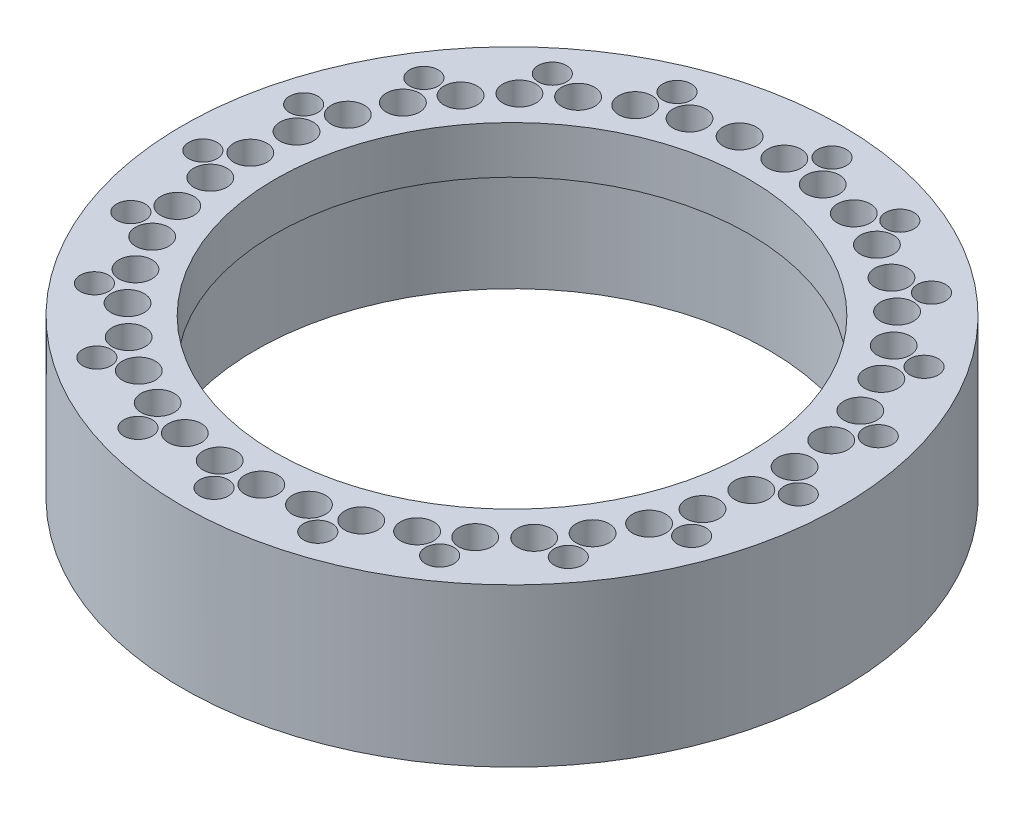
from build123d import *

# Parameters (mm, degrees)
BOSS_EXTRUDE1_OUTLINE_R                              = 37
BOSS_EXTRUDE1_OUTLINE_R_2                            = 2.1
BOSS_EXTRUDE1_OUTLINE_R_3                            = 32
BOSS_EXTRUDE1_DEPTH                                  = 4
BOSS_EXTRUDE2_START                                  = -2
SKETCH2_R                                            = 37
SKETCH2_R_2                                          = 32
BOSS_EXTRUDE2_DEPTH                                  = 2
BOSS_EXTRUDE3_OUTLINE_W                              = 2
BOSS_EXTRUDE3_OUTLINE_H                              = 4
BOSS_EXTRUDE4_START                                  = 4
SKETCH4_R                                            = 37
SKETCH4_R_2                                          = 32.5
BOSS_EXTRUDE4_DEPTH                                  = 4
BOSS_EXTRUDE5_START                                  = 10
SKETCH5_R                                            = 40
SKETCH5_R_2                                          = 32.5
BOSS_EXTRUDE5_DEPTH                                  = 10
SKETCH6_R                                            = 40
SKETCH6_R_2                                          = 37
BOSS_EXTRUDE6_DEPTH                                  = 10
M3_CLEARANCE_HOLE1_D                                 = 3.4
SKETCH9_R                                            = 41.75
SKETCH9_R_2                                          = 40
BOSS_EXTRUDE7_DEPTH                                  = 20
CSK_FOR_M3_SOCKET_COUNTERSUNK_HEAD_SCREW_D           = 3.6
CSK_FOR_M3_SOCKET_COUNTERSUNK_HEAD_SCREW_CSINK_D     = 6.94
CSK_FOR_M3_SOCKET_COUNTERSUNK_HEAD_SCREW_CSINK_ANGLE = 90
SKETCH13_R                                           = 32
SKETCH13_R_2                                         = 30
BOSS_EXTRUDE8_DEPTH                                  = 2


# Read off the part's stored shape, not the designer's step: Boss-Extrude1, Boss-Extrude3
with BuildPart() as part:
    # Boss-Extrude1 outline → Boss-Extrude1 (new body)
    with BuildSketch(Plane(origin=(0, 0, 0), x_dir=(1, 0, 0), z_dir=(0, 1, 0))):
        Circle(BOSS_EXTRUDE1_OUTLINE_R)
        with Locations((-28.958107202, -18.753080475)):
            Circle(BOSS_EXTRUDE1_OUTLINE_R_2, mode=Mode.SUBTRACT)
        with Locations((-21.95036426, -26.616376704)):
            Circle(BOSS_EXTRUDE1_OUTLINE_R_2, mode=Mode.SUBTRACT)
        with Locations((-25.756086146, -22.953736656)):
            Circle(BOSS_EXTRUDE1_OUTLINE_R_2, mode=Mode.SUBTRACT)
        with Locations((-17.630144441, -29.655151441)):
            Circle(BOSS_EXTRUDE1_OUTLINE_R_2, mode=Mode.SUBTRACT)
        with Locations((-12.896688979, -31.998834563)):
            Circle(BOSS_EXTRUDE1_OUTLINE_R_2, mode=Mode.SUBTRACT)
        with Locations((-7.860946057, -33.592492124)):
            Circle(BOSS_EXTRUDE1_OUTLINE_R_2, mode=Mode.SUBTRACT)
        with Locations((-2.640949223, -34.398770141)):
            Circle(BOSS_EXTRUDE1_OUTLINE_R_2, mode=Mode.SUBTRACT)
        with Locations((-31.481374768, -14.112867982)):
            Circle(BOSS_EXTRUDE1_OUTLINE_R_2, mode=Mode.SUBTRACT)
        with Locations((-33.266745593, -9.141861826)):
            Circle(BOSS_EXTRUDE1_OUTLINE_R_2, mode=Mode.SUBTRACT)
        with Locations((-34.272372097, -3.956578176)):
            Circle(BOSS_EXTRUDE1_OUTLINE_R_2, mode=Mode.SUBTRACT)
        with Locations((2.640949223, -34.398770141)):
            Circle(BOSS_EXTRUDE1_OUTLINE_R_2, mode=Mode.SUBTRACT)
        with Locations((7.860946057, -33.592492124)):
            Circle(BOSS_EXTRUDE1_OUTLINE_R_2, mode=Mode.SUBTRACT)
        with Locations((12.896688979, -31.998834563)):
            Circle(BOSS_EXTRUDE1_OUTLINE_R_2, mode=Mode.SUBTRACT)
        with Locations((17.630144441, -29.655151441)):
            Circle(BOSS_EXTRUDE1_OUTLINE_R_2, mode=Mode.SUBTRACT)
        with Locations((21.95036426, -26.616376704)):
            Circle(BOSS_EXTRUDE1_OUTLINE_R_2, mode=Mode.SUBTRACT)
        with Locations((25.756086146, -22.953736656)):
            Circle(BOSS_EXTRUDE1_OUTLINE_R_2, mode=Mode.SUBTRACT)
        with Locations((28.958107202, -18.753080475)):
            Circle(BOSS_EXTRUDE1_OUTLINE_R_2, mode=Mode.SUBTRACT)
        with Locations((31.481374768, -14.112867982)):
            Circle(BOSS_EXTRUDE1_OUTLINE_R_2, mode=Mode.SUBTRACT)
        with Locations((33.266745593, -9.141861826)):
            Circle(BOSS_EXTRUDE1_OUTLINE_R_2, mode=Mode.SUBTRACT)
        with Locations((34.272372097, -3.956578176)):
            Circle(BOSS_EXTRUDE1_OUTLINE_R_2, mode=Mode.SUBTRACT)
        with Locations((-34.474683246, 1.321444312)):
            Circle(BOSS_EXTRUDE1_OUTLINE_R_2, mode=Mode.SUBTRACT)
        with Locations((-33.86893704, 6.568493266)):
            Circle(BOSS_EXTRUDE1_OUTLINE_R_2, mode=Mode.SUBTRACT)
        with Locations((-32.469331655, 11.661582305)):
            Circle(BOSS_EXTRUDE1_OUTLINE_R_2, mode=Mode.SUBTRACT)
        with Locations((-30.308672656, 16.481333739)):
            Circle(BOSS_EXTRUDE1_OUTLINE_R_2, mode=Mode.SUBTRACT)
        with Locations((-27.437604059, 20.914776678)):
            Circle(BOSS_EXTRUDE1_OUTLINE_R_2, mode=Mode.SUBTRACT)
        with Locations((-23.923421277, 24.857994979)):
            Circle(BOSS_EXTRUDE1_OUTLINE_R_2, mode=Mode.SUBTRACT)
        with Locations((-19.848493778, 28.218562946)):
            Circle(BOSS_EXTRUDE1_OUTLINE_R_2, mode=Mode.SUBTRACT)
        with Locations((-15.308334406, 30.917711715)):
            Circle(BOSS_EXTRUDE1_OUTLINE_R_2, mode=Mode.SUBTRACT)
        with Locations((-10.409360652, 32.892175526)):
            Circle(BOSS_EXTRUDE1_OUTLINE_R_2, mode=Mode.SUBTRACT)
        with Locations((-5.266400306, 34.09567462)):
            Circle(BOSS_EXTRUDE1_OUTLINE_R_2, mode=Mode.SUBTRACT)
        Circle(BOSS_EXTRUDE1_OUTLINE_R_3, mode=Mode.SUBTRACT)
        with Locations((34.474683246, 1.321444312)):
            Circle(BOSS_EXTRUDE1_OUTLINE_R_2, mode=Mode.SUBTRACT)
        with Locations((33.86893704, 6.568493266)):
            Circle(BOSS_EXTRUDE1_OUTLINE_R_2, mode=Mode.SUBTRACT)
        with Locations((32.469331655, 11.661582305)):
            Circle(BOSS_EXTRUDE1_OUTLINE_R_2, mode=Mode.SUBTRACT)
        with Locations((30.308672656, 16.481333739)):
            Circle(BOSS_EXTRUDE1_OUTLINE_R_2, mode=Mode.SUBTRACT)
        with Locations((0, 34.5)):
            Circle(BOSS_EXTRUDE1_OUTLINE_R_2, mode=Mode.SUBTRACT)
        with Locations((5.266400306, 34.09567462)):
            Circle(BOSS_EXTRUDE1_OUTLINE_R_2, mode=Mode.SUBTRACT)
        with Locations((15.308334406, 30.917711715)):
            Circle(BOSS_EXTRUDE1_OUTLINE_R_2, mode=Mode.SUBTRACT)
        with Locations((10.409360652, 32.892175526)):
            Circle(BOSS_EXTRUDE1_OUTLINE_R_2, mode=Mode.SUBTRACT)
        with Locations((27.437604059, 20.914776678)):
            Circle(BOSS_EXTRUDE1_OUTLINE_R_2, mode=Mode.SUBTRACT)
        with Locations((23.923421277, 24.857994979)):
            Circle(BOSS_EXTRUDE1_OUTLINE_R_2, mode=Mode.SUBTRACT)
        with Locations((19.848493778, 28.218562946)):
            Circle(BOSS_EXTRUDE1_OUTLINE_R_2, mode=Mode.SUBTRACT)
    extrude(amount=BOSS_EXTRUDE1_DEPTH)

    # Sketch2 → Boss-Extrude2 (add)
    with BuildSketch(Plane(origin=(0, 0, 0), x_dir=(1, 0, 0), z_dir=(0, 1, 0)).offset(BOSS_EXTRUDE2_START)):
        with Locations(Location((0, 0, 0), (0, 0, 270))):
            Circle(SKETCH2_R)
        with Locations(Location((0, 0, 0), (0, 0, 270))):
            Circle(SKETCH2_R_2, mode=Mode.SUBTRACT)
    extrude(amount=BOSS_EXTRUDE2_DEPTH)

    # Boss-Extrude3 outline → Boss-Extrude3 (revolve)
    with BuildSketch(Plane.XY):
        with Locations((31, 0)):
            Rectangle(BOSS_EXTRUDE3_OUTLINE_W, BOSS_EXTRUDE3_OUTLINE_H)
    revolve(axis=Axis((0, 0, 0), (0, 1, 0)))

    # Sketch4 → Boss-Extrude4 (add)
    with BuildSketch(Plane.XZ.offset(2).offset(BOSS_EXTRUDE4_START)):
        with Locations(Location((0, 0, 0), (0, 0, 270))):
            Circle(SKETCH4_R)
        with Locations(Location((0, 0, 0), (0, 0, 270))):
            Circle(SKETCH4_R_2, mode=Mode.SUBTRACT)
    extrude(amount=-BOSS_EXTRUDE4_DEPTH)

    # Sketch5 → Boss-Extrude5 (add)
    with BuildSketch(Plane.XZ.offset(6).offset(BOSS_EXTRUDE5_START)):
        with Locations(Location((0, 0, 0), (0, 0, 270))):
            Circle(SKETCH5_R)
        with Locations(Location((0, 0, 0), (0, 0, 270))):
            Circle(SKETCH5_R_2, mode=Mode.SUBTRACT)
    extrude(amount=-BOSS_EXTRUDE5_DEPTH)

    # Sketch6 → Boss-Extrude6 (add)
    with BuildSketch(Plane(origin=(0, -6, 0), x_dir=(1, 0, 0), z_dir=(0, 1, 0))):
        with Locations(Location((0, 0, 0), (0, 0, 270))):
            Circle(SKETCH6_R)
        Circle(SKETCH6_R_2, mode=Mode.SUBTRACT)
    extrude(amount=BOSS_EXTRUDE6_DEPTH)

    # M3 Clearance Hole1 (through all)
    with Locations(Plane(origin=(0, 4, 0), x_dir=(1, 0, 0), z_dir=(0, 1, 0))):
        with Locations((-14.111594462, 35.013217529), (2.889734295, 37.639233995), (14.111594462, 35.013217529), (24.018152198, 29.123716538), (31.686044836, 20.519675013), (36.400569453, 10.003051708), (37.722298335, -1.445928197), (35.528036811, -12.76013716), (30.022305891, -22.885009264), (21.718279423, -30.876833369), (11.389952597, -35.9907138), (0, -37.75), (-11.389952597, -35.9907138), (-21.718279423, -30.876833369), (-30.022305891, -22.885009264), (-35.528036811, -12.76013716), (-37.722298335, -1.445928197), (-36.400569453, 10.003051708), (-31.686044836, 20.519675013), (-24.018152198, 29.123716538)):
            Hole(M3_CLEARANCE_HOLE1_D / 2)

    # Sketch9 → Boss-Extrude7 (add)
    with BuildSketch(Plane(origin=(0, -16, 0), x_dir=(1, 0, 0), z_dir=(0, 1, 0))):
        with Locations(Location((0, 0, 0), (0, 0, 90))):
            Circle(SKETCH9_R)
        Circle(SKETCH9_R_2, mode=Mode.SUBTRACT)
    extrude(amount=BOSS_EXTRUDE7_DEPTH)

    # CSK for M3 socket countersunk head screw1 (through all)
    with Locations(Plane(origin=(0, -16, 0), x_dir=(-1, 0, 0), z_dir=(0, -1, 0))):
        with Locations((14.111594462, 35.013217529), (24.017656287, 29.124125506), (31.685346016, 20.520754075), (36.400058422, 10.004911138), (37.72239673, -1.443358912), (35.529123055, -12.757112327), (30.024643795, -22.881941897), (21.721959578, -30.874244478), (11.394855176, -35.989161917), (0.005785128, -37.749999557), (-11.383824076, -35.992652714), (-21.712495699, -30.88090074), (-30.017629142, -22.891143281), (-35.525211372, -12.768001292), (-37.721952573, -1.45492064), (-36.403123186, 9.993754165), (-31.691634074, 20.511041653), (-24.026581612, 29.116762802), (-14.12232524, 35.008890725), (-2.901911355, 37.638297125)):
            CounterSinkHole(CSK_FOR_M3_SOCKET_COUNTERSUNK_HEAD_SCREW_D / 2, CSK_FOR_M3_SOCKET_COUNTERSUNK_HEAD_SCREW_CSINK_D / 2, counter_sink_angle=CSK_FOR_M3_SOCKET_COUNTERSUNK_HEAD_SCREW_CSINK_ANGLE)

    # Sketch13 → Boss-Extrude8 (add)
    with BuildSketch(Plane(origin=(0, 2, 0), x_dir=(1, 0, 0), z_dir=(0, 1, 0))):
        Circle(SKETCH13_R)
        with Locations(Location((0, 0, 0), (0, 0, 90))):
            Circle(SKETCH13_R_2, mode=Mode.SUBTRACT)
    extrude(amount=BOSS_EXTRUDE8_DEPTH)


solid = part.part
